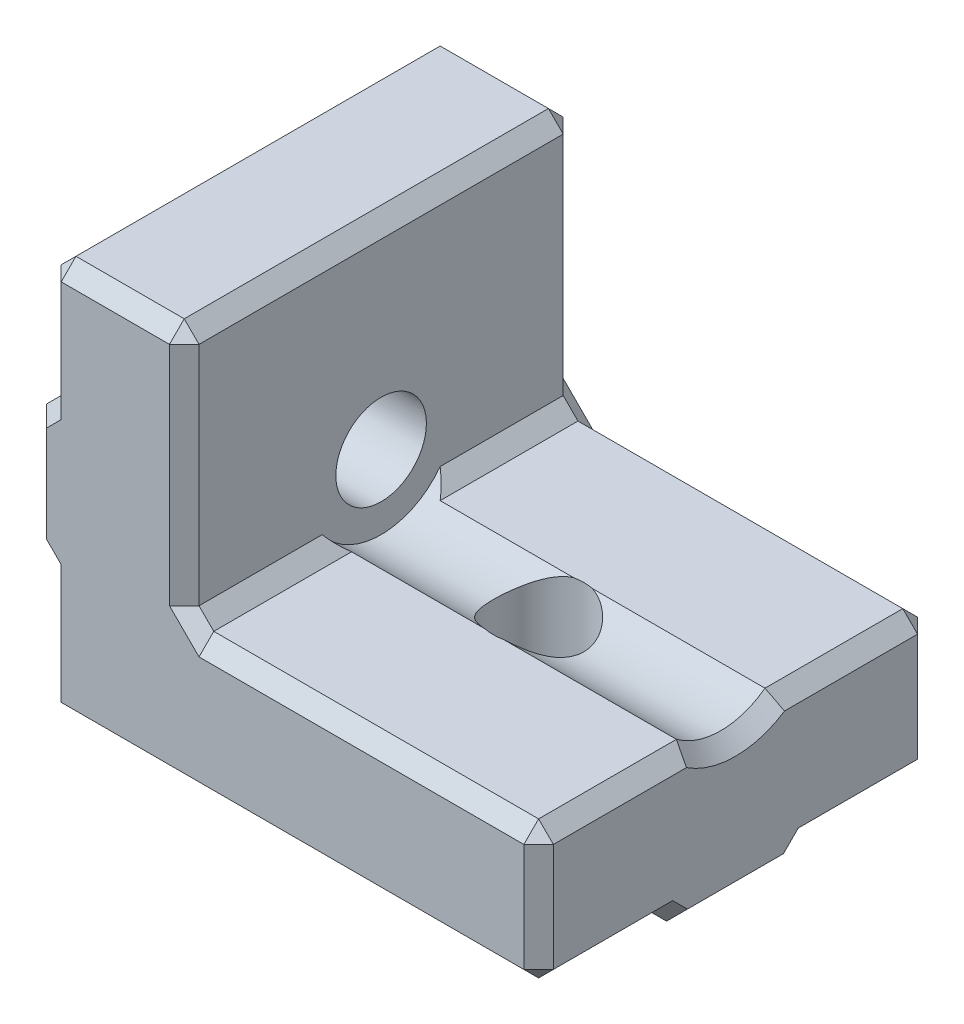
from build123d import *

# Parameters (mm, degrees)
AUFSATZ_LINEAR_AUSTRAGEN1_DEPTH      = 20
AUFSATZ_LINEAR_AUSTRAGEN2_DEPTH      = 20
AUFSATZ_LINEAR_AUSTRAGEN3_DEPTH      = 25
SCHNITT_LINEAR_AUSTRAGEN1_DEPTH      = 20
SCHNITT_LINEAR_AUSTRAGEN1_DEPTH_BACK = 20
SKIZZE2_R                            = 2.3
SKIZZE3_R                            = 3.75
SCHNITT_LINEAR_AUSTRAGEN2_DEPTH      = 34.526109228
SKIZZE4_R                            = 2.3
SCHNITT_LINEAR_AUSTRAGEN3_DEPTH      = 20
FASE1_SIZE                           = 0.75
VERRUNDUNG1_R                        = 2
SKIZZE7_R                            = 4.15
SCHNITT_LINEAR_AUSTRAGEN4_DEPTH      = 20
SKIZZE8_R                            = 4.15
SCHNITT_LINEAR_AUSTRAGEN5_DEPTH      = 20
VERRUNDUNG2_R                        = 1


with BuildPart() as part:
    # Skizze1 → Aufsatz-Linear austragen1 (new body)
    with BuildSketch(Plane.XY):
        Polygon((0, 0), (0, 20), (7, 20), (7, 7), (25, 7), (25, 0), align=None)
    extrude(amount=AUFSATZ_LINEAR_AUSTRAGEN1_DEPTH)

    # Skizze5 → Aufsatz-Linear austragen2 (add)
    with BuildSketch(Plane(origin=(0, 0, 0), x_dir=(-1, 0, 0), z_dir=(0, 0, -1))):
        Polygon((0, 6.5), (0, 13.5), (0.75, 12.75), (0.75, 7.25), align=None)
    extrude(amount=-AUFSATZ_LINEAR_AUSTRAGEN2_DEPTH)

    # Skizze6 → Aufsatz-Linear austragen3 (add)
    with BuildSketch(Plane.ZY):
        Polygon((6.5, 0), (13.5, 0), (12.75, -0.75), (7.25, -0.75), align=None)
    extrude(amount=-AUFSATZ_LINEAR_AUSTRAGEN3_DEPTH)

    # Skizze2 → Schnitt-Linear austragen1 (cut, two sides: drawn at the far end of the back side and taken through both)
    with BuildSketch(Plane.ZY.offset(-SCHNITT_LINEAR_AUSTRAGEN1_DEPTH_BACK)):
        with Locations(Location((10, 10, 0), (0, 0, 270))):
            Circle(SKIZZE2_R)
    extrude(amount=SCHNITT_LINEAR_AUSTRAGEN1_DEPTH + SCHNITT_LINEAR_AUSTRAGEN1_DEPTH_BACK, mode=Mode.SUBTRACT)

    # Skizze3 → Schnitt-Linear austragen2 (cut, through all)
    with BuildSketch(Plane(origin=(7, 0, 0), x_dir=(0, 0, -1), z_dir=(1, 0, 0))):
        with Locations((-10, 10)):
            Circle(SKIZZE3_R)
    extrude(amount=SCHNITT_LINEAR_AUSTRAGEN2_DEPTH, mode=Mode.SUBTRACT)

    # Skizze4 → Schnitt-Linear austragen3 (cut)
    with BuildSketch(Plane(origin=(0, 7, 0), x_dir=(1, 0, 0), z_dir=(0, 1, 0))):
        with Locations(Location((15, -10, 0), (0, 0, 258.031254445))):
            Circle(SKIZZE4_R)
    extrude(amount=-SCHNITT_LINEAR_AUSTRAGEN3_DEPTH, mode=Mode.SUBTRACT)

    # Fase1
    fase1_edges = [part.edges().sort_by_distance(p)[0] for p in [
        (0, 20, 10),
        (7, 20, 10),
        (7, 7, 16.125),
        (25, 7, 16.125),
        (25, 0, 16.75),
        (16, 7, 20),
        (7, 13.5, 20),
        (0, 3.25, 0),
        (0, 3.25, 20),
        (3.5, 20, 20),
        (-0.375, 6.875, 20),
        (-0.375, 13.125, 20),
        (-0.75, 10, 20),
        (-0.375, 6.875, 0),
        (-0.75, 10, 0),
        (-0.375, 13.125, 0),
        (0, 16.75, 20),
        (25, 0, 3.25),
        (25, -0.375, 13.125),
        (25, -0.75, 10),
        (25, -0.375, 6.875),
        (12.5, 0, 20),
        (7, 7, 3.875),
        (25, 7, 3.875),
        (25, 6.25, 10),
        (0, 16.75, 0),
        (3.5, 20, 0),
        (7, 13.5, 0),
        (16, 7, 0),
        (25, 3.5, 0),
        (12.5, 0, 0),
        (25, 3.5, 20),
    ]]
    chamfer(fase1_edges, length=FASE1_SIZE)

    # Verrundung1
    verrundung1_edges = [part.edges().sort_by_distance(p)[0] for p in [
        (0, 0, 3.625),
        (0, -0.375, 13.125),
        (0, -0.375, 6.875),
        (0, -0.75, 10),
        (0, 0, 16.375),
    ]]
    fillet(verrundung1_edges, radius=VERRUNDUNG1_R)

    # Skizze7 → Schnitt-Linear austragen4 (cut)
    with BuildSketch(Plane.ZY):
        with Locations((10, 10)):
            Circle(SKIZZE7_R)
    extrude(amount=SCHNITT_LINEAR_AUSTRAGEN4_DEPTH, mode=Mode.SUBTRACT)

    # Skizze8 → Schnitt-Linear austragen5 (cut)
    with BuildSketch(Plane.XZ):
        with Locations((15, 10)):
            Circle(SKIZZE8_R)
    extrude(amount=SCHNITT_LINEAR_AUSTRAGEN5_DEPTH, mode=Mode.SUBTRACT)

    # Verrundung2
    # the kernel refuses this fillet: 1 mm, written as the material it takes off along each edge
    with BuildSketch(Plane(origin=(15, -0.75, 10), x_dir=(-0.259943773458836, 0, -0.9656237541817109), z_dir=(0.9656237541817109, 0, -0.259943773458836))) as verrundung2_piece_1:
        with BuildLine():
            CenterArc((5.118245837, 1), VERRUNDUNG2_R, 194.477512186, 75.522487814)
            Line((4.15, 0.75), (4.130635083, 0.745))
            ThreePointArc((4.130635083, 0.745), (4.13, 0.375), (4.13, 0))
            Line((4.13, 0), (4.15, -0.02))
            Line((4.15, -0.02), (5.118245837, -0.02))
            Line((5.118245837, -0.02), (5.118245837, 0))
        make_face()
    revolve(axis=Axis((15, -0.75, 10), (0, 1, 0)), revolution_arc=149.866548224, mode=Mode.SUBTRACT)
    with BuildSketch(Plane(origin=(15, -0.75, 10), x_dir=(0.259943773458836, 0, -0.9656237541817109), z_dir=(-0.9656237541817109, 0, -0.259943773458836))) as verrundung2_piece_2:
        with BuildLine():
            CenterArc((5.118245837, -1), VERRUNDUNG2_R, 90, 75.522487814)
            Line((4.15, -0.75), (4.130635083, -0.745))
            ThreePointArc((4.130635083, -0.745), (4.13, -0.375), (4.13, 0))
            Line((4.13, 0), (4.15, 0.02))
            Line((4.15, 0.02), (5.118245837, 0.02))
            Line((5.118245837, 0.02), (5.118245837, 0))
        make_face()
    revolve(axis=Axis((15, -0.75, 10), (0, -1, 0)), revolution_arc=149.866548224, mode=Mode.SUBTRACT)
    with BuildSketch(Plane(origin=(-0.75, 10, 10), x_dir=(0, -0.9656237541817109, -0.2599437734588364), z_dir=(0, -0.2599437734588364, 0.9656237541817109))) as verrundung2_piece_3:
        with BuildLine():
            CenterArc((5.118245837, 1), VERRUNDUNG2_R, 194.477512186, 75.522487814)
            Line((4.15, 0.75), (4.130635083, 0.745))
            ThreePointArc((4.130635083, 0.745), (4.13, 0.375), (4.13, 0))
            Line((4.13, 0), (4.15, -0.02))
            Line((4.15, -0.02), (5.118245837, -0.02))
            Line((5.118245837, -0.02), (5.118245837, 0))
        make_face()
    revolve(axis=Axis((-0.75, 10, 10), (1, 0, 0)), revolution_arc=149.866548224, mode=Mode.SUBTRACT)
    with BuildSketch(Plane(origin=(-0.75, 10, 10), x_dir=(0, -0.9656237541817109, 0.2599437734588359), z_dir=(0, -0.2599437734588359, -0.9656237541817109))) as verrundung2_piece_4:
        with BuildLine():
            CenterArc((5.118245837, -1), VERRUNDUNG2_R, 90, 75.522487814)
            Line((4.15, -0.75), (4.130635083, -0.745))
            ThreePointArc((4.130635083, -0.745), (4.13, -0.375), (4.13, 0))
            Line((4.13, 0), (4.15, 0.02))
            Line((4.15, 0.02), (5.118245837, 0.02))
            Line((5.118245837, 0.02), (5.118245837, 0))
        make_face()
    revolve(axis=Axis((-0.75, 10, 10), (-1, 0, 0)), revolution_arc=149.866548224, mode=Mode.SUBTRACT)


solid = part.part
